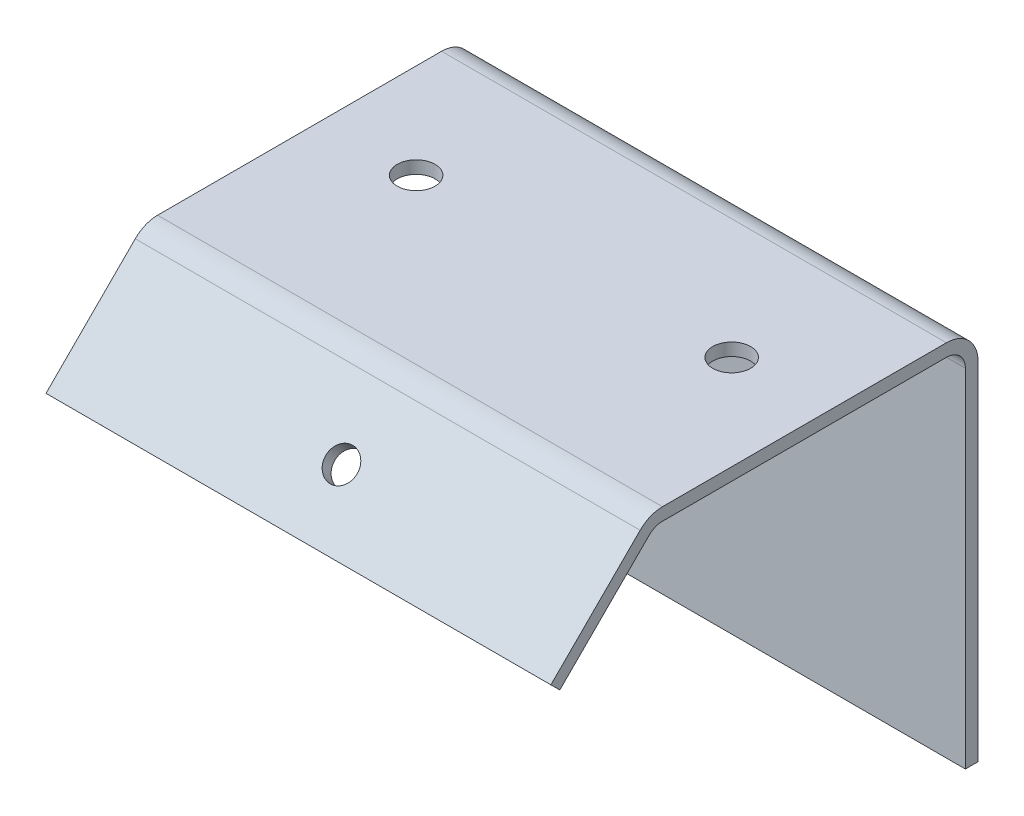
from build123d import *
from OCP.BRepAlgoAPI import BRepAlgoAPI_Cut
from OCP.TopTools import TopTools_ListOfShape

# Parameters (mm, degrees)
EXTRUDE_START       = -40
EXTRUDE_1_DEPTH     = 80
SKETCH_2_R          = 4
CUT_EXTRUDE_1_DEPTH = 99.895232583
SKETCH_3_R          = 3
CUT_EXTRUDE_2_DEPTH = 99.895232848
SWEEP_6_PROFILE_R   = 2.5


with BuildPart() as part:
    # 凸台-拉伸1: read off the stored shape, not the designer's step
    # 凸台-拉伸1 outline → 凸台-拉伸1 (new body)
    with BuildSketch(Plane(origin=(0, 0, 0), x_dir=(0, 0, -1), z_dir=(1, 0, 0)).offset(EXTRUDE_START)):
        with BuildLine():
            Line((-1.999999781, -5.28e-07), (8.38e-07, -5.28e-07))
            Line((8.38e-07, -5.28e-07), (8.38e-07, 54.999999472))
            ThreePointArc((8.38e-07, 54.999999472), (-1.464465344, 58.535533909), (-4.999999781, 60.000000091))
            Line((-4.999999781, 60.000000091), (-49.999999781, 60.000000091))
            ThreePointArc((-49.999999781, 60.000000091), (-51.913417169, 59.619397955), (-53.535534, 58.535534))
            Line((-53.535534, 58.535534), (-67.67767, 44.393398))
            Line((-67.67767, 44.393398), (-66.262742, 42.978678))
            Line((-66.262742, 42.978678), (-52.12132, 57.12132))
            ThreePointArc((-52.12132, 57.12132), (-51.148050068, 57.771638319), (-49.999999781, 57.999999472))
            Line((-49.999999781, 57.999999472), (-4.999999781, 57.999999472))
            ThreePointArc((-4.999999781, 57.999999472), (-2.878679344, 57.121319909), (-1.999999781, 54.999999472))
            Line((-1.999999781, 54.999999472), (-1.999999781, -5.28e-07))
        make_face()
    extrude(amount=EXTRUDE_1_DEPTH)


with BuildPart() as cut_extrude_1_tool:
    # 草图2 → 切除-拉伸1 (new, through all)
    with BuildSketch(Plane.XY):
        with Locations(Location((0, 25, 0), (0, 0, 180))):
            Circle(SKETCH_2_R)
    extrude(amount=CUT_EXTRUDE_1_DEPTH)


with BuildPart() as part_1:
    add(part.part)

    # 切除-拉伸1: cut by cut_extrude_1_tool, with a tolerance
    cut_extrude_1_stock = TopTools_ListOfShape()
    cut_extrude_1_stock.Append(part_1.part.wrapped)
    cut_extrude_1_tools = TopTools_ListOfShape()
    cut_extrude_1_tools.Append(cut_extrude_1_tool.part.wrapped)
    cut_extrude_1_cut = BRepAlgoAPI_Cut()
    cut_extrude_1_cut.SetArguments(cut_extrude_1_stock)
    cut_extrude_1_cut.SetTools(cut_extrude_1_tools)
    cut_extrude_1_cut.SetFuzzyValue(0.00001)
    cut_extrude_1_cut.Build()
    add(Compound.cast(cut_extrude_1_cut.Shape()).solids(), mode=Mode.REPLACE)

    # 草图3 → 切除-拉伸2 (cut, through all)
    with BuildSketch(Plane(origin=(0, 60, 0), x_dir=(1, 0, 0), z_dir=(0, 1, 0))):
        with Locations(Location((-25, -24.031, 0), (0, 0, 270))):
            Circle(SKETCH_3_R)
        with Locations(Location((25, -24.031, 0), (0, 0, 270))):
            Circle(SKETCH_3_R)
    extrude(amount=-CUT_EXTRUDE_2_DEPTH, mode=Mode.SUBTRACT)

    # 切除-扫描6: sweep along a curve in space
    with BuildLine() as sweep_6_path:
        Line((0, 53.11, 62.755), (0, 46.038932, 55.683932))
    # 切除-扫描6 profile (on start of the path) → 切除-扫描6 (sweep, cut)
    with BuildSketch(Plane(origin=(0, 53.11, 62.755), x_dir=(0, -0.7071067811865479, 0.7071067811865471), z_dir=(0, -0.7071067811865471, -0.7071067811865479))):
        Circle(SWEEP_6_PROFILE_R)
    sweep(path=sweep_6_path.line, mode=Mode.SUBTRACT)


solid = part_1.part
